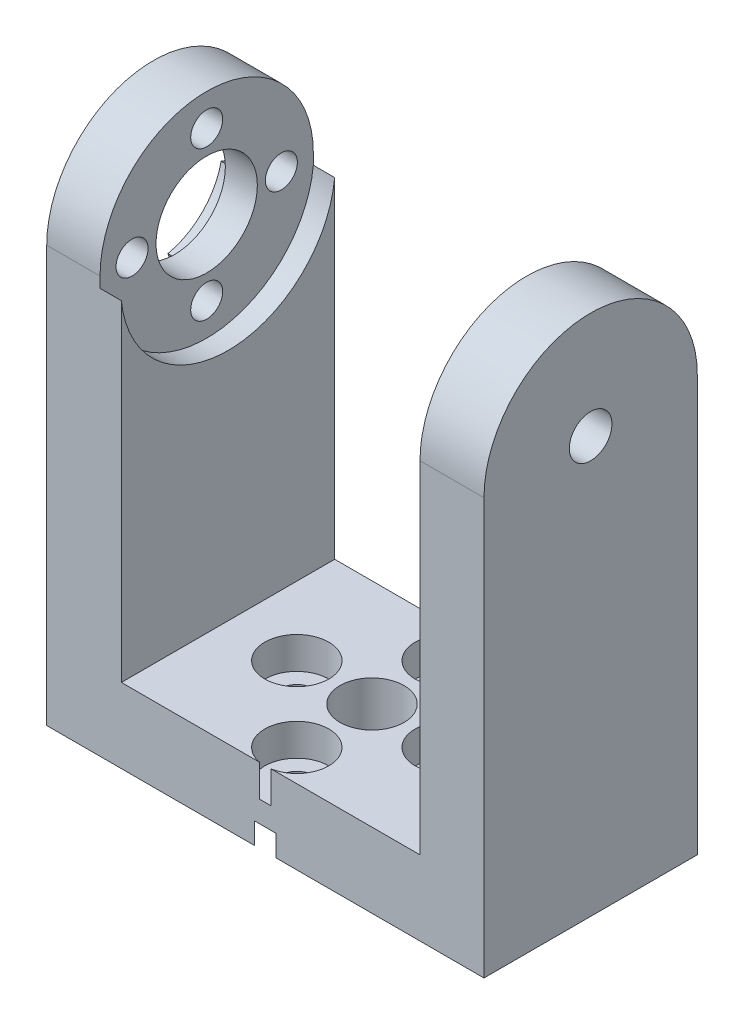
from build123d import *

# Parameters (mm, degrees)
SKETCH1_W                = 41
SKETCH1_H                = 20
BOSS_EXTRUDE2_DEPTH      = 7
SKETCH3_R                = 10.05
CUT_EXTRUDE8_DEPTH       = 2
SKETCH4_R                = 1.5
SKETCH4_R_2              = 3
CUT_EXTRUDE9_DEPTH       = 29
SKETCH5_W                = 6
SKETCH5_H                = 20
SKETCH5_W_2              = 7
BOSS_EXTRUDE3_DEPTH      = 36
CUT_EXTRUDE10_DEPTH      = 36
SKETCH7_R                = 2
CUT_EXTRUDE11_DEPTH      = 51
SKETCH8_R                = 10.05
CUT_EXTRUDE12_DEPTH      = 2
SKETCH9_R                = 4.75
CUT_EXTRUDE13_DEPTH      = 3.25
SKETCH10_R               = 6.5
CUT_EXTRUDE14_DEPTH      = 2
CUT_EXTRUDE15_DEPTH      = 14
CUT_EXTRUDE15_DEPTH_BACK = 10
SKETCH12_R               = 1.5
CUT_EXTRUDE16_DEPTH      = 10
CUT_EXTRUDE17_DEPTH      = 10
MIRROR1_START            = 5
MIRROR1_DEPTH            = 2
MIRROR1_2_DEPTH          = 7
MIRROR1_3_DEPTH          = 5
CUT_EXTRUDE18_DEPTH      = 10
CUT_EXTRUDE18_DEPTH_BACK = 10
BOSS_EXTRUDE4_START      = 16
BOSS_EXTRUDE4_DEPTH      = 16
BOSS_EXTRUDE6_START      = -21
SKETCH16_W               = 28
SKETCH16_H               = 20
SKETCH16_R               = 1.5
SKETCH16_R_2             = 3
BOSS_EXTRUDE6_DEPTH      = 21
SKETCH18_W               = 28
SKETCH18_H               = 20
CUT_EXTRUDE21_DEPTH      = 16
CROQUIS2_R               = 3
CORTAR_EXTRUIR1_DEPTH    = 3
CROQUIS3_R               = 4
CORTAR_EXTRUIR2_DEPTH    = 0.3


# Read off the part's stored shape, not the designer's step: Mirror1
with BuildPart() as part:
    # Sketch1 → Boss-Extrude2 (new body)
    with BuildSketch(Plane(origin=(0, 0, 0), x_dir=(1, 0, 0), z_dir=(0, 1, 0))):
        with Locations((20.5, 10)):
            Rectangle(SKETCH1_W, SKETCH1_H)
    extrude(amount=BOSS_EXTRUDE2_DEPTH)

    # Sketch3 → Cut-Extrude8 (cut)
    with BuildSketch(Plane.XZ):
        with Locations((20.5, -10)):
            Circle(SKETCH3_R)
    extrude(amount=-CUT_EXTRUDE8_DEPTH, mode=Mode.SUBTRACT)

    # Sketch4 → Cut-Extrude9 (cut)
    with BuildSketch(Plane.XZ.offset(-2)):
        with Locations(Location((20.5, -2.95, 0), (0, 0, 270))):
            Circle(SKETCH4_R)
        with Locations(Location((27.55, -10, 0), (0, 0, 270))):
            Circle(SKETCH4_R)
        with Locations(Location((20.5, -17.05, 0), (0, 0, 270))):
            Circle(SKETCH4_R)
        with Locations(Location((13.45, -10, 0), (0, 0, 270))):
            Circle(SKETCH4_R)
        with Locations(Location((20.5, -10, 0), (0, 0, 270))):
            Circle(SKETCH4_R_2)
    extrude(amount=-CUT_EXTRUDE9_DEPTH, mode=Mode.SUBTRACT)

    # Sketch5 → Boss-Extrude3 (add)
    with BuildSketch(Plane(origin=(0, 7, 0), x_dir=(1, 0, 0), z_dir=(0, 1, 0))):
        with Locations((38, 10)):
            Rectangle(SKETCH5_W, SKETCH5_H)
        with Locations((3.5, 10)):
            Rectangle(SKETCH5_W_2, SKETCH5_H)
    extrude(amount=BOSS_EXTRUDE3_DEPTH)

    # Sketch6 → Cut-Extrude10 (cut)
    with BuildSketch(Plane.XY):
        Polygon((0, 33), (71.43253461, 33), (71.43253461, 55.308458538), (-13.966778087, 55.308458538), align=None)
    extrude(amount=-CUT_EXTRUDE10_DEPTH, mode=Mode.SUBTRACT)

    # Sketch7 → Cut-Extrude11 (cut)
    with BuildSketch(Plane.ZY):
        with Locations((-10, 23)):
            Circle(SKETCH7_R)
    extrude(amount=-CUT_EXTRUDE11_DEPTH, mode=Mode.SUBTRACT)

    # Sketch8 → Cut-Extrude12 (cut)
    with BuildSketch(Plane.ZY):
        with Locations((-10, 23)):
            Circle(SKETCH8_R)
    extrude(amount=-CUT_EXTRUDE12_DEPTH, mode=Mode.SUBTRACT)

    # Sketch9 → Cut-Extrude13 (cut)
    with BuildSketch(Plane.ZY.offset(-2)):
        with Locations((-10, 23)):
            Circle(SKETCH9_R)
    extrude(amount=-CUT_EXTRUDE13_DEPTH, mode=Mode.SUBTRACT)

    # Sketch10 → Cut-Extrude14 (cut)
    with BuildSketch(Plane(origin=(7, 0, 0), x_dir=(0, 0, -1), z_dir=(1, 0, 0))):
        with Locations((10, 23)):
            Circle(SKETCH10_R)
    extrude(amount=-CUT_EXTRUDE14_DEPTH, mode=Mode.SUBTRACT)

    # Sketch11 → Cut-Extrude15 (cut, two sides: drawn at the far end of the back side and taken through both)
    with BuildSketch(Plane.ZY.offset(-2).offset(-CUT_EXTRUDE15_DEPTH_BACK)):
        with BuildLine():
            Line((0, 23), (15.490351621, 23))
            Line((15.490351621, 23), (12.295560885, 45.157965149))
            Line((12.295560885, 45.157965149), (-24.464924867, 45.157965149))
            Line((-24.464924867, 45.157965149), (-29.902866546, 24.493786768))
            Line((-29.902866546, 24.493786768), (-20, 23))
            ThreePointArc((-20, 23), (-10, 33), (0, 23))
        make_face()
    extrude(amount=CUT_EXTRUDE15_DEPTH + CUT_EXTRUDE15_DEPTH_BACK, mode=Mode.SUBTRACT)

    # Sketch12 → Cut-Extrude16 (cut)
    with BuildSketch(Plane.ZY.offset(-2)):
        with Locations((-10, 30)):
            Circle(SKETCH12_R)
        with Locations((-3, 23)):
            Circle(SKETCH12_R)
        with Locations((-10, 16)):
            Circle(SKETCH12_R)
        with Locations((-17, 23)):
            Circle(SKETCH12_R)
    extrude(amount=-CUT_EXTRUDE16_DEPTH, mode=Mode.SUBTRACT)

    # Sketch13 → Cut-Extrude17 (cut)
    with BuildSketch(Plane(origin=(41, 0, 0), x_dir=(0, 0, -1), z_dir=(1, 0, 0))):
        with BuildLine():
            Line((20, 23), (26.17535893, 23))
            Line((26.17535893, 23), (24.098367316, 34.532076054))
            Line((24.098367316, 34.532076054), (-4.476002155, 34.532076054))
            Line((-4.476002155, 34.532076054), (-5.608906672, 23))
            Line((-5.608906672, 23), (0, 23))
            ThreePointArc((0, 23), (10, 33), (20, 23))
        make_face()
    extrude(amount=-CUT_EXTRUDE17_DEPTH, mode=Mode.SUBTRACT)

    # Mirror1 outline → Mirror1 (cut)
    with BuildSketch(Plane.YZ.offset(MIRROR1_START)):
        with BuildLine():
            Line((23, 0), (21.99875078, 0))
            ThreePointArc((21.99875078, 0), (12.95, -10), (21.99875078, -20))
            Line((21.99875078, -20), (23, -20))
            ThreePointArc((23, -20), (33, -10), (23, 0))
        make_face()
        with BuildLine():
            ThreePointArc((24.355261854, -16.357142857), (23, -18.5), (21.644738146, -16.357142857))
            ThreePointArc((21.644738146, -16.357142857), (18.403805922, -14.596194078), (16.642857143, -11.355261854))
            ThreePointArc((16.642857143, -11.355261854), (14.5, -10), (16.642857143, -8.644738146))
            ThreePointArc((16.642857143, -8.644738146), (18.403805922, -5.403805922), (21.644738146, -3.642857143))
            ThreePointArc((21.644738146, -3.642857143), (23, -1.5), (24.355261854, -3.642857143))
            ThreePointArc((24.355261854, -3.642857143), (27.596194078, -5.403805922), (29.357142857, -8.644738146))
            ThreePointArc((29.357142857, -8.644738146), (31.5, -10), (29.357142857, -11.355261854))
            ThreePointArc((29.357142857, -11.355261854), (27.596194078, -14.596194078), (24.355261854, -16.357142857))
        make_face(mode=Mode.SUBTRACT)
    extrude(amount=MIRROR1_DEPTH, mode=Mode.SUBTRACT)



with BuildPart() as body_2:
    # Mirror1 2 outline → Mirror1 2 (new body)
    with BuildSketch(Plane.YZ):
        with BuildLine():
            Line((43, 0), (24.00124922, 0))
            ThreePointArc((24.00124922, 0), (33.05, -10), (24.00124922, -20))
            Line((24.00124922, -20), (43, -20))
            Line((43, -20), (43, 0))
        make_face()
    extrude(amount=MIRROR1_2_DEPTH)


with BuildPart() as part_1:
    add(part.part)

    add(body_2.part)  # Mirror1 3 merges body 2
    # Mirror1 3 outline → Mirror1 3 (add)
    with BuildSketch(Plane.YZ):
        with BuildLine():
            ThreePointArc((21.99875078, 0), (12.95, -10), (21.99875078, -20))
            Line((21.99875078, -20), (24.00124922, -20))
            ThreePointArc((24.00124922, -20), (33.05, -10), (24.00124922, 0))
            Line((24.00124922, 0), (21.99875078, 0))
        make_face()
        with BuildLine():
            ThreePointArc((24.355261854, -16.357142857), (23, -18.5), (21.644738146, -16.357142857))
            ThreePointArc((21.644738146, -16.357142857), (18.403805922, -14.596194078), (16.642857143, -11.355261854))
            ThreePointArc((16.642857143, -11.355261854), (14.5, -10), (16.642857143, -8.644738146))
            ThreePointArc((16.642857143, -8.644738146), (18.403805922, -5.403805922), (21.644738146, -3.642857143))
            ThreePointArc((21.644738146, -3.642857143), (23, -1.5), (24.355261854, -3.642857143))
            ThreePointArc((24.355261854, -3.642857143), (27.596194078, -5.403805922), (29.357142857, -8.644738146))
            ThreePointArc((29.357142857, -8.644738146), (31.5, -10), (29.357142857, -11.355261854))
            ThreePointArc((29.357142857, -11.355261854), (27.596194078, -14.596194078), (24.355261854, -16.357142857))
        make_face(mode=Mode.SUBTRACT)
    extrude(amount=MIRROR1_3_DEPTH)

    # Sketch14 → Cut-Extrude18 (cut, two sides: drawn at the far end of the back side and taken through both)
    with BuildSketch(Plane(origin=(5, 0, 0), x_dir=(0, 0, -1), z_dir=(1, 0, 0)).offset(-CUT_EXTRUDE18_DEPTH_BACK)):
        with BuildLine():
            Line((20, 23), (39.442144398, 23))
            Line((39.442144398, 23), (24.053498228, 52.618460363))
            Line((24.053498228, 52.618460363), (-15.863160605, 48.721271778))
            Line((-15.863160605, 48.721271778), (-25.901373625, 22.149531431))
            Line((-25.901373625, 22.149531431), (0, 23))
            ThreePointArc((0, 23), (10, 33), (20, 23))
        make_face()
    extrude(amount=CUT_EXTRUDE18_DEPTH + CUT_EXTRUDE18_DEPTH_BACK, mode=Mode.SUBTRACT)

    # Sketch15 → Boss-Extrude4 (add)
    with BuildSketch(Plane.XZ.offset(BOSS_EXTRUDE4_START)):
        with BuildLine():
            Line((21.50124922, 0), (41, 0))
            Line((41, 0), (41, -20))
            Line((41, -20), (21.50124922, -20))
            ThreePointArc((21.50124922, -20), (30.55, -10), (21.50124922, 0))
        make_face()
        with BuildLine():
            Line((0, 0), (19.49875078, 0))
            ThreePointArc((19.49875078, 0), (10.45, -10), (19.49875078, -20))
            Line((19.49875078, -20), (0, -20))
            Line((0, -20), (0, 0))
        make_face()
    extrude(amount=-BOSS_EXTRUDE4_DEPTH)

    # Sketch16 → Boss-Extrude6 (add)
    with BuildSketch(Plane(origin=(0, 7, 0), x_dir=(1, 0, 0), z_dir=(0, 1, 0)).offset(BOSS_EXTRUDE6_START)):
        with Locations((21, 10)):
            Rectangle(SKETCH16_W, SKETCH16_H)
        with Locations(Location((27.55, 10, 0), (0, 0, 90))):
            Circle(SKETCH16_R, mode=Mode.SUBTRACT)
        with Locations(Location((20.5, 10, 0), (0, 0, 90))):
            Circle(SKETCH16_R_2, mode=Mode.SUBTRACT)
        with Locations(Location((13.45, 10, 0), (0, 0, 90))):
            Circle(SKETCH16_R, mode=Mode.SUBTRACT)
        with Locations(Location((20.5, 17.05, 0), (0, 0, 90))):
            Circle(SKETCH16_R, mode=Mode.SUBTRACT)
        with Locations(Location((20.5, 2.95, 0), (0, 0, 90))):
            Circle(SKETCH16_R, mode=Mode.SUBTRACT)
    extrude(amount=BOSS_EXTRUDE6_DEPTH)

    # Sketch18 → Cut-Extrude21 (cut)
    with BuildSketch(Plane(origin=(0, 7, 0), x_dir=(1, 0, 0), z_dir=(0, 1, 0))):
        with Locations((21, 10)):
            Rectangle(SKETCH18_W, SKETCH18_H)
    extrude(amount=-CUT_EXTRUDE21_DEPTH, mode=Mode.SUBTRACT)

    # Croquis2 → Cortar-Extruir1 (cut)
    with BuildSketch(Plane(origin=(0, -9, 0), x_dir=(1, 0, 0), z_dir=(0, 1, 0))):
        with Locations(Location((27.55, 10, 0), (0, 0, 270))):
            Circle(CROQUIS2_R)
        with Locations((20.5, 17.05)):
            Circle(CROQUIS2_R)
        with Locations(Location((13.45, 10, 0), (0, 0, 270))):
            Circle(CROQUIS2_R)
        with Locations((20.5, 2.95)):
            Circle(CROQUIS2_R)
    extrude(amount=-CORTAR_EXTRUIR1_DEPTH, mode=Mode.SUBTRACT)

    # Croquis3 → Cortar-Extruir2 (cut)
    with BuildSketch(Plane.ZY.offset(-35)):
        with Locations((-10, 23)):
            Circle(CROQUIS3_R)
    extrude(amount=-CORTAR_EXTRUIR2_DEPTH, mode=Mode.SUBTRACT)


solid = part_1.part
